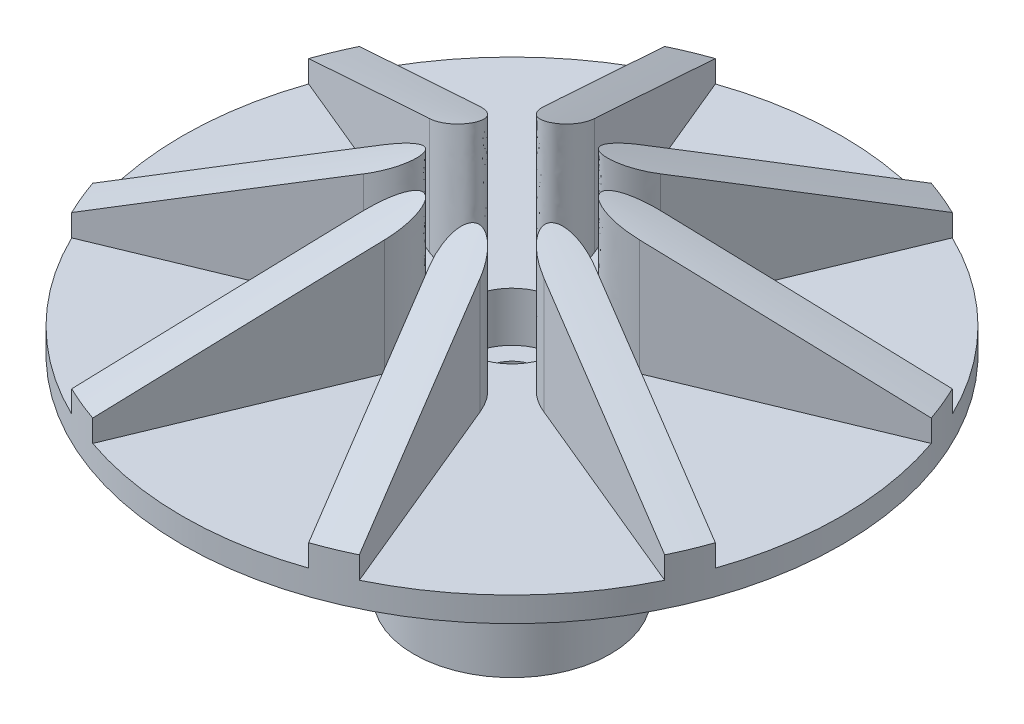
from build123d import *
from build123d.topology import SkipClean

# Parameters (mm, degrees)
SKETCH1_R                       = 26.6319
IMPELLER_PLATE_DEPTH            = 2.000000064
SKETCH6_R                       = 7.9375
BOSS_DEPTH                      = 17.000000036
SKETCH7_R                       = 2.1828125
BOLT_BORE_DEPTH                 = 43.184312238
SKETCH8_R                       = 4
SHAFT_BORE_DEPTH                = 11.999999876
SKETCH9_R                       = 3.75
BOLT_HEAD_BORE_DEPTH            = 4.000000128
SKETCH11_W                      = 12.00000013
SKETCH11_H                      = 2.000000064
DOWEL_SLOT_DEPTH                = 3.000000096
OPENING_START                   = -1
OPENING_ALINGMENT_CUT_DEPTH     = 1
OPENING_ALINGMENT_PATTERN_COUNT = 8
ONE_BLADE_DEPTH                 = 10.746677965
OPENING_START_2                 = -2.000000064
SKETCH15_R                      = 26.6319
SKETCH15_R_2                    = 3.75
OPENING_ALIGNMENT_FILL_DEPTH    = 2.000000064
CIRPATTERN2_COUNT               = 8


with BuildPart() as part:
    # Sketch1 → impeller plate (new body)
    with BuildSketch(Plane(origin=(0, 0, 0), x_dir=(1, 0, 0), z_dir=(0, 1, 0))):
        Circle(SKETCH1_R)
    extrude(amount=IMPELLER_PLATE_DEPTH)

    # Sketch6 → boss (add)
    with BuildSketch(Plane(origin=(0, 0, 0), x_dir=(-1, 0, 0), z_dir=(0, -1, 0))):
        Circle(SKETCH6_R)
    extrude(amount=BOSS_DEPTH)

    # Sketch7 → bolt bore (cut, through all)
    with BuildSketch(Plane(origin=(0, -17.000000036, 0), x_dir=(-1, 0, 0), z_dir=(0, -1, 0))):
        Circle(SKETCH7_R)
    extrude(amount=-BOLT_BORE_DEPTH, mode=Mode.SUBTRACT)

    # Sketch8 → shaft bore (cut)
    with BuildSketch(Plane(origin=(0, -17.000000036, 0), x_dir=(-1, 0, 0), z_dir=(0, -1, 0))):
        Circle(SKETCH8_R)
    extrude(amount=-SHAFT_BORE_DEPTH, mode=Mode.SUBTRACT)

    # Sketch9 → bolt head bore (cut)
    with BuildSketch(Plane(origin=(0, 2.000000064, 0), x_dir=(1, 0, 0), z_dir=(0, 1, 0))):
        Circle(SKETCH9_R)
    extrude(amount=-BOLT_HEAD_BORE_DEPTH, mode=Mode.SUBTRACT)

    # Sketch11 → dowel slot (cut)
    with BuildSketch(Plane.XZ.offset(17.000000036)):
        Rectangle(SKETCH11_W, SKETCH11_H)
    extrude(amount=-DOWEL_SLOT_DEPTH, mode=Mode.SUBTRACT)

    # Sketch12 → opening alingment cut (cut)
    with BuildSketch(Plane(origin=(0, 2.000000064, 0), x_dir=(1, 0, 0), z_dir=(0, 1, 0)).offset(OPENING_START)):
        with BuildLine():
            Line((5.228658549, 1.389745954), (26.595614371, 1.389745954))
            ThreePointArc((26.595614371, 1.389745954), (26.6319, 0), (26.595614371, -1.389745954))
            Line((26.595614371, -1.389745954), (5.228658549, -1.389745954))
            ThreePointArc((5.228658549, -1.389745954), (5.4102, 0), (5.228658549, 1.389745954))
        make_face()
    opening_alingment_cut = extrude(amount=OPENING_ALINGMENT_CUT_DEPTH, mode=Mode.SUBTRACT)

    # opening alingment pattern: opening alingment cut ×8 about axis
    opening_alingment_pattern_axis = Axis((0, 2.000000064, 0), (0, 1, 0))
    for i in range(1, OPENING_ALINGMENT_PATTERN_COUNT):
        add(opening_alingment_cut.rotate(opening_alingment_pattern_axis, i * 360 / OPENING_ALINGMENT_PATTERN_COUNT), mode=Mode.SUBTRACT)

    # Sketch14 → one blade (add)
    with SkipClean():  # the faces are left unmerged after this step: merging them gives an invalid solid
        with BuildSketch(Plane(origin=(0, 2.000000064, 0), x_dir=(1, 0, 0), z_dir=(0, 1, 0))):
            with BuildLine():
                Line((7.294176633, 4.717477681), (23.962365155, 11.621667427))
                ThreePointArc((23.962365155, 11.621667427), (24.604667322, 10.191586902), (25.161710741, 8.726191048))
                Line((25.161710741, 8.726191048), (8.493522218, 1.822001302))
                add(Edge.make_bspline(
                    [(7.294176633, 4.717477681), (4.398700254, 3.518132095), (4.998373047, 2.070393906), (5.59804584, 0.622655716), (8.493522218, 1.822001302)],
                    knots=[1.570796327, 1.570796327, 1.570796327, 3.141592654, 3.141592654, 4.71238898, 4.71238898, 4.71238898], degree=2, weights=[1, 0.707106781, 1, 0.707106781, 1]))
            make_face()
        one_blade = extrude(amount=ONE_BLADE_DEPTH)

    # Sketch15 → opening alignment fill (add)
    with SkipClean():  # the faces are left unmerged after this step: merging them gives an invalid solid
        with BuildSketch(Plane(origin=(0, 2.000000064, 0), x_dir=(1, 0, 0), z_dir=(0, 1, 0)).offset(OPENING_START_2)):
            Circle(SKETCH15_R)
            Circle(SKETCH15_R_2, mode=Mode.SUBTRACT)
        extrude(amount=OPENING_ALIGNMENT_FILL_DEPTH)

    # CirPattern2: one blade ×8 about axis
    with SkipClean():  # the faces are left unmerged after this step: merging them gives an invalid solid
        cirpattern2_axis = Axis((0, 2.000000064, 0), (0, 1, 0))
        for i in range(1, CIRPATTERN2_COUNT):
            add(one_blade.rotate(cirpattern2_axis, i * 360 / CIRPATTERN2_COUNT))

    # Sketch16 → angle cut (revolve, cut)
    with SkipClean():  # the faces are left unmerged after this step: merging them gives an invalid solid
        with BuildSketch(Plane(origin=(0, 0, 0), x_dir=(0, 0, -1), z_dir=(1, 0, 0))):
            Polygon((5.4102, 12.746678029), (26.6319, 3.778000064), (26.6319, 12.746678029), align=None)
        revolve(axis=Axis((0, 0, 0), (0, 1, 0)), mode=Mode.SUBTRACT)


solid = part.part
